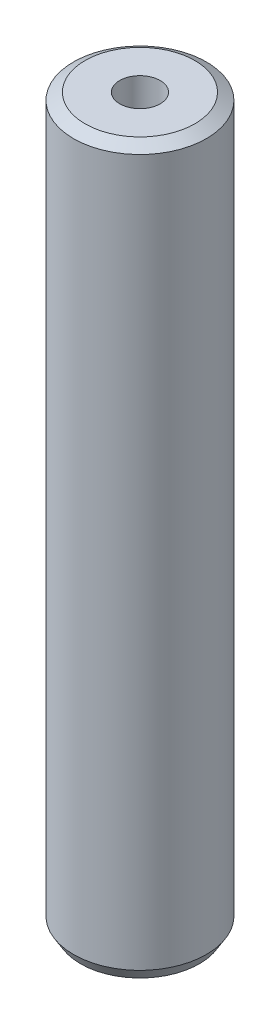
from build123d import *
from OCP.BRepFilletAPI import BRepFilletAPI_MakeChamfer

# Parameters (mm, degrees)
SKETCH1_R           = 55
BOSS_EXTRUDE1_DEPTH = 600
SKETCH2_R           = 16.747379528
CUT_EXTRUDE1_DEPTH  = 606.020660804
CHAMFER1_SIZE       = 5.809010038
CHAMFER1_SIZE2      = 9.594877105


with BuildPart() as part:
    # Sketch1 → Boss-Extrude1 (new body)
    with BuildSketch(Plane(origin=(0, 0, 0), x_dir=(1, 0, 0), z_dir=(0, 1, 0))):
        Circle(SKETCH1_R)
    extrude(amount=BOSS_EXTRUDE1_DEPTH)

    # Sketch2 → Cut-Extrude1 (cut, through all)
    with BuildSketch(Plane(origin=(0, 0, 0), x_dir=(1, 0, 0), z_dir=(0, 1, 0))):
        Circle(SKETCH2_R)
    extrude(amount=CUT_EXTRUDE1_DEPTH, mode=Mode.SUBTRACT)

    # Chamfer1: one chamfer whose edges measure the first distance from different faces: ONE call of the kernel's chamfer builder (chamfer() names one face for all edges)
    chamfer1_edges_1 = [part.edges().sort_by_distance(p)[0] for p in [
        (-55, 600, 0),
    ]]
    chamfer1_side_1 = [part.faces().sort_by_distance(p)[0] for p in [
        (-55, 300, 0),
    ]]
    chamfer1_edges_2 = [part.edges().sort_by_distance(p)[0] for p in [
        (-55, 0, 0),
    ]]
    chamfer1_side_2 = [part.faces().sort_by_distance(p)[0] for p in [
        (-53.444365081, 0, 0),
    ]]
    chamfer1 = BRepFilletAPI_MakeChamfer(part.part.solid().wrapped)
    for e in chamfer1_edges_1:
        chamfer1.Add(CHAMFER1_SIZE, CHAMFER1_SIZE2, e.wrapped, chamfer1_side_1[0].wrapped)  # the first distance lies on this face
    for e in chamfer1_edges_2:
        chamfer1.Add(CHAMFER1_SIZE, CHAMFER1_SIZE2, e.wrapped, chamfer1_side_2[0].wrapped)  # the first distance lies on this face
    add(Compound.cast(chamfer1.Shape()), mode=Mode.REPLACE)


solid = part.part
